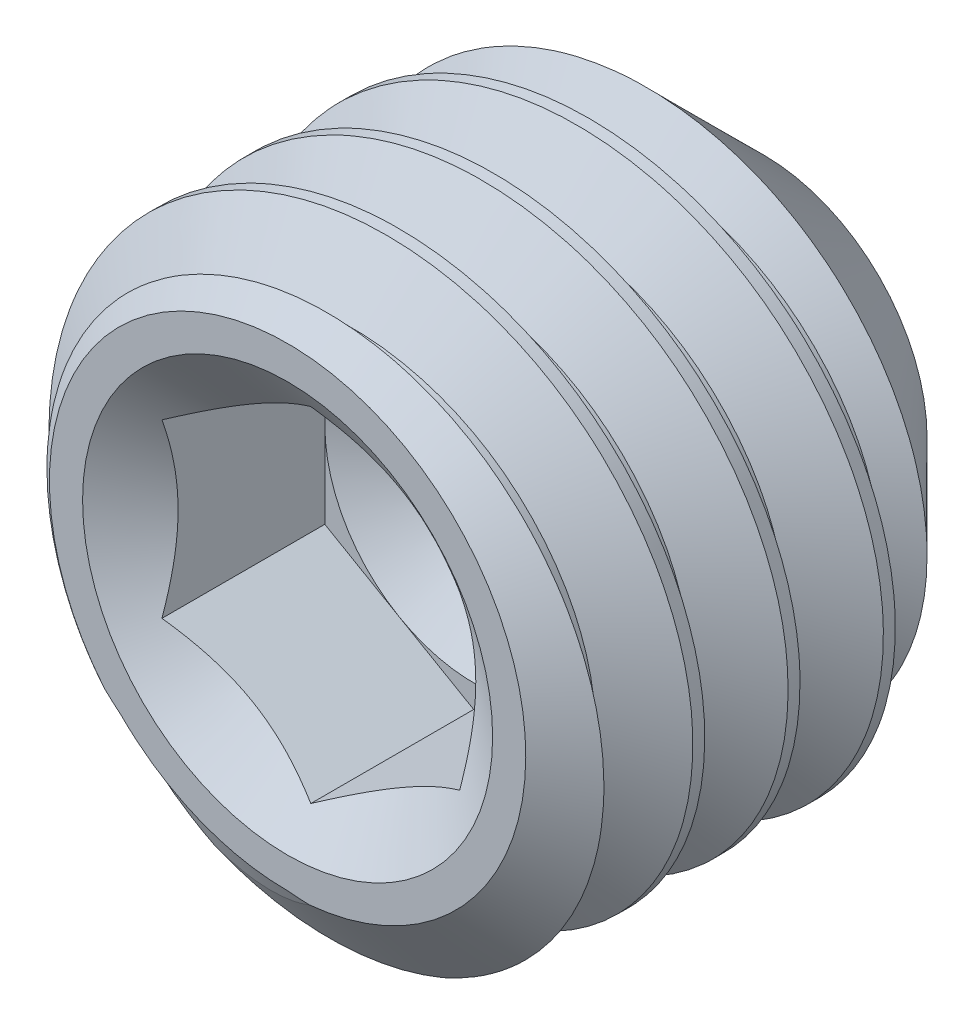
from build123d import *

# Parameters (mm, degrees)
CUT_EXTRUDE1_DEPTH = 1.5625
CUT_SWEEP1_PITCH   = 0.8


with BuildPart() as part:
    # Sketch1 → Revolve1 (revolve)
    with BuildSketch(Plane(origin=(0, 0, 0), x_dir=(0, 0, -1), z_dir=(1, 0, 0)), mode=Mode.PRIVATE) as revolve1_sk:
        Polygon((-1.588436834, 0), (-1.588436834, 2), (-1.238333065, 2.5), (1.281475432, 2.5), (2.411563166, 1.369912266), (1.588436834, 0), align=None)
    revolve(revolve1_sk.sketch.rotate(Axis((0, 0, -1.588436834), (0, 0, -1)), 180), axis=Axis((0, 0, -1.588436834), (0, 0, -1)))

    # Sketch2 → Cut-Extrude1 (cut)
    with BuildSketch(Plane.XY.offset(1.588436834)):
        Polygon((0, 1.443375673), (-1.25, 0.721687836), (-1.25, -0.721687836), (0, -1.443375673), (1.25, -0.721687836), (1.25, 0.721687836), align=None)
    extrude(amount=-CUT_EXTRUDE1_DEPTH, mode=Mode.SUBTRACT)

    # Cut-Extrude2 cone 1 section (through the dimple's axis) → Cut-Extrude2 (revolve, cut)
    with BuildSketch(Plane(origin=(0, 0, 1.588436834), x_dir=(0, -1, 0), z_dir=(1, 0, 0))):
        Polygon((0, 0), (1.721687836, 0), (0, 1.205538802), align=None)
    revolve(axis=Axis((0, 0, 1.588436834), (0, 0, -1)), mode=Mode.SUBTRACT)

    # Cut-Extrude3 cone 1 section (through the dimple's axis) → Cut-Extrude3 (revolve, cut)
    with BuildSketch(Plane(origin=(0, 0, 0.025936834), x_dir=(0, -1, 0), z_dir=(1, 0, 0))):
        Polygon((0, 0), (1.25, 0), (0, 0.721687836), align=None)
    revolve(axis=Axis((0, 0, 0.025936834), (0, 0, -1)), mode=Mode.SUBTRACT)

    # Cut-Sweep1: the profile of Sketch6 screwed along a right-hand helix of 6 turns, 8 arcs to a turn; built about Z, then put on its axis
    cut_sweep1_z = Axis((0, 0, 0), (0, 0, 1))
    cut_sweep1_corners = [(1.980384758, 0, -0.3), (2.54330127, 0, 0.025), (2.54330127, 0, -0.725), (1.980384758, 0, -0.4)]
    with BuildLine(mode=Mode.PRIVATE) as cut_sweep1_profile:
        Line(cut_sweep1_corners[0], cut_sweep1_corners[1])
        Line(cut_sweep1_corners[1], cut_sweep1_corners[2])
        Line(cut_sweep1_corners[2], cut_sweep1_corners[3])
        Line(cut_sweep1_corners[3], cut_sweep1_corners[0])
    cut_sweep1_cap = Face(cut_sweep1_profile.wire())
    cut_sweep1_turn_angles = [0, 22.5, 45, 67.5, 90, 112.5, 135, 157.5, 180, 202.5, 225, 247.5, 270, 292.5, 315, 337.5, 360]
    cut_sweep1_turn_weights = [1, 0.9238795325112867, 1, 0.9238795325112867, 1, 0.9238795325112867, 1, 0.9238795325112867, 1, 0.9238795325112867, 1, 0.9238795325112867, 1, 0.9238795325112867, 1, 0.9238795325112867, 1]
    cut_sweep1_turn_rails = [Edge.make_bspline([Vector(p[0], p[1], 0).rotate(cut_sweep1_z, cut_sweep1_turn_angles[k]) / cut_sweep1_turn_weights[k] + Vector(0, 0, p[2] + CUT_SWEEP1_PITCH * cut_sweep1_turn_angles[k] / 360) for k in range(17)], [0, 0, 0, 1, 1, 2, 2, 3, 3, 4, 4, 5, 5, 6, 6, 7, 7, 8, 8, 8], 2, cut_sweep1_turn_weights) for p in cut_sweep1_corners]
    cut_sweep1_turn_sides = [Face.make_surface_from_curves(cut_sweep1_turn_rails[p[0]], cut_sweep1_turn_rails[p[1]]) for p in [(0, 1), (1, 2), (2, 3), (3, 0)]]
    cut_sweep1 = Plane(origin=(0, 0, -2.411563166), x_dir=(0, 1, 0), z_dir=(0, 0, 1)) * Solid(Shell([*[p.moved(Location((0, 0, CUT_SWEEP1_PITCH * i))) for i in range(6) for p in cut_sweep1_turn_sides], cut_sweep1_cap, cut_sweep1_cap.rotate(cut_sweep1_z, 2160).moved(Location((0, 0, CUT_SWEEP1_PITCH * 2160 / 360)))]))
    add(cut_sweep1, mode=Mode.SUBTRACT)


solid = part.part
